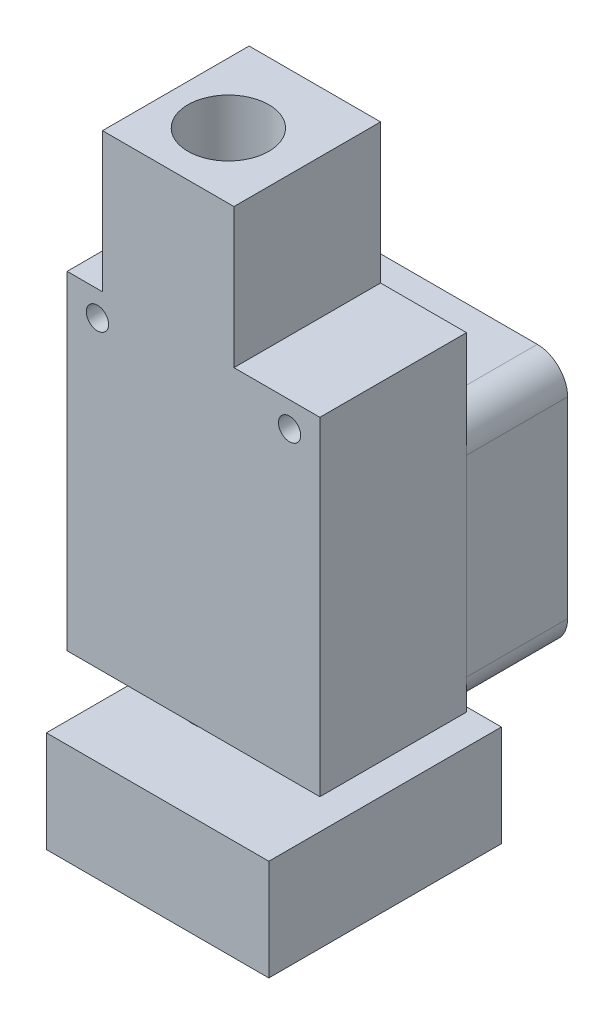
from build123d import *

# Parameters (mm, degrees)
BOSS_EXTRUDE1_DEPTH        = 6.45
BOSS_EXTRUDE1_DEPTH_BACK   = 8.05
SKETCH1_R                  = 1.1
BOSS_EXTRUDE1_2_DEPTH      = 6.45
BOSS_EXTRUDE1_2_DEPTH_BACK = 8.05
SKETCH1_W                  = 22
SKETCH1_H                  = 10
SKETCH1_7_W                = 6.5
SKETCH1_7_H                = 10
SKETCH1_7_W_2              = 12
BOSS_EXTRUDE2_DEPTH        = 11.5
SKETCH2_W                  = 25
SKETCH2_H                  = 25
SKETCH2_R                  = 11
SKETCH2_R_2                = 5
BOSS_EXTRUDE3_DEPTH        = 10
CUT_EXTRUDE1_START         = 10
SKETCH2_3_R                = 11
SKETCH2_3_R_2              = 5
CUT_EXTRUDE1_DEPTH         = 3
FILLET1_R                  = 3


# Read off the part's stored shape, not the designer's step: Revolve1
with BuildPart() as part:
    # Sketch1 → Boss-Extrude1 (new, two sides: drawn at the far end of the back side and taken through both)
    with BuildSketch(Plane.XY.offset(-BOSS_EXTRUDE1_DEPTH_BACK)):
        Polygon((7, 0), (-6, 0), (-6, -13.8), (-9.5, -13.8), (-9.5, -46.3), (15.5, -46.3), (15.5, -13.8), (7, -13.8), align=None)
        with Locations((-6.5, -16.3)):
            Circle(SKETCH1_R, mode=Mode.SUBTRACT)
        with Locations((12.5, -16.3)):
            Circle(SKETCH1_R, mode=Mode.SUBTRACT)
    extrude(amount=BOSS_EXTRUDE1_DEPTH + BOSS_EXTRUDE1_DEPTH_BACK)

    # Sketch1<6> → Cut-Revolve1 (revolve, cut)
    with BuildSketch(Plane.XY, mode=Mode.PRIVATE) as cut_revolve1_sk:
        Polygon((4, -6), (4, 0), (0, 0), (0, -46.3), (0.875, -46.3), (0.875, -6), align=None)
    revolve(cut_revolve1_sk.sketch.rotate(Axis((0, -281.964182831, 0), (0, 1, 0)), 180), axis=Axis((0, -281.964182831, 0), (0, 1, 0)), mode=Mode.SUBTRACT)


with BuildPart() as body_2:
    # Sketch1 → Boss-Extrude1 2 (new, two sides: drawn at the far end of the back side and taken through both)
    with BuildSketch(Plane.XY.offset(-BOSS_EXTRUDE1_2_DEPTH_BACK)):
        with Locations((4.5, -54.3)):
            Rectangle(SKETCH1_W, SKETCH1_H)
    extrude(amount=BOSS_EXTRUDE1_2_DEPTH + BOSS_EXTRUDE1_2_DEPTH_BACK)

    # Sketch1<7> → Boss-Extrude2 (add, symmetric)
    with BuildSketch(Plane.XY):
        with Locations((-3.25, -54.3)):
            Rectangle(SKETCH1_7_W, SKETCH1_7_H)
        Polygon((0.772208122, -49.3), (0, -49.3), (0, -59.3), (0.429568528, -59.3), align=None)
        Polygon((3.5, -49.3), (0.772208122, -49.3), (0.429568528, -59.3), (3.5, -59.3), align=None)
        with Locations((9.5, -54.3)):
            Rectangle(SKETCH1_7_W_2, SKETCH1_7_H)
    extrude(amount=BOSS_EXTRUDE2_DEPTH, both=True)


with BuildPart() as body_3:
    # Revolve1 outline → Revolve1 (revolve)
    with BuildSketch(Plane.XY):
        Polygon((0.875, -46.3), (0.2, -66), (0.2, -68), (0.4, -68), (3.5, -63.960001344), (3.5, -46.3), align=None)
    revolve(axis=Axis((0, 0, 0), (0, 1, 0)))


with BuildPart() as body_4:
    # Sketch2 → Boss-Extrude3 (new body)
    # profile 1 of 3: a face of its own
    with BuildSketch(Plane(origin=(0, 0, -8.05), x_dir=(-1, 0, 0), z_dir=(0, 0, -1))):
        with Locations((-3, -33.8)):
            Rectangle(SKETCH2_W, SKETCH2_H)
        with Locations((-3, -34.1)):
            Circle(SKETCH2_R, mode=Mode.SUBTRACT)
    # profile 2 of 3: a face of its own
    with BuildSketch(Plane(origin=(0, 0, -8.05), x_dir=(-1, 0, 0), z_dir=(0, 0, -1))):
        with Locations((-3, -34.1)):
            Circle(SKETCH2_R)
        with Locations((-3, -34.1)):
            Circle(SKETCH2_R_2, mode=Mode.SUBTRACT)
    # profile 3 of 3: a face of its own
    with BuildSketch(Plane(origin=(0, 0, -8.05), x_dir=(-1, 0, 0), z_dir=(0, 0, -1))):
        with Locations((-3, -34.1)):
            Circle(SKETCH2_R_2)
    extrude(amount=BOSS_EXTRUDE3_DEPTH)

    # Sketch2<3> → Cut-Extrude1 (cut)
    with BuildSketch(Plane(origin=(0, 0, -8.05), x_dir=(-1, 0, 0), z_dir=(0, 0, -1)).offset(CUT_EXTRUDE1_START)):
        with Locations((-3, -34.1)):
            Circle(SKETCH2_3_R)
        with Locations((-3, -34.1)):
            Circle(SKETCH2_3_R_2, mode=Mode.SUBTRACT)
    extrude(amount=-CUT_EXTRUDE1_DEPTH, mode=Mode.SUBTRACT)

    # Fillet1
    fillet1_edges = [body_4.edges().sort_by_distance(p)[0] for p in [
        (-9.5, -21.3, -13.05),
        (-9.5, -46.3, -13.05),
        (15.5, -46.3, -13.05),
        (15.5, -21.3, -13.05),
    ]]
    fillet(fillet1_edges, radius=FILLET1_R)


solid = Compound([part.part, body_2.part, body_3.part, body_4.part])
